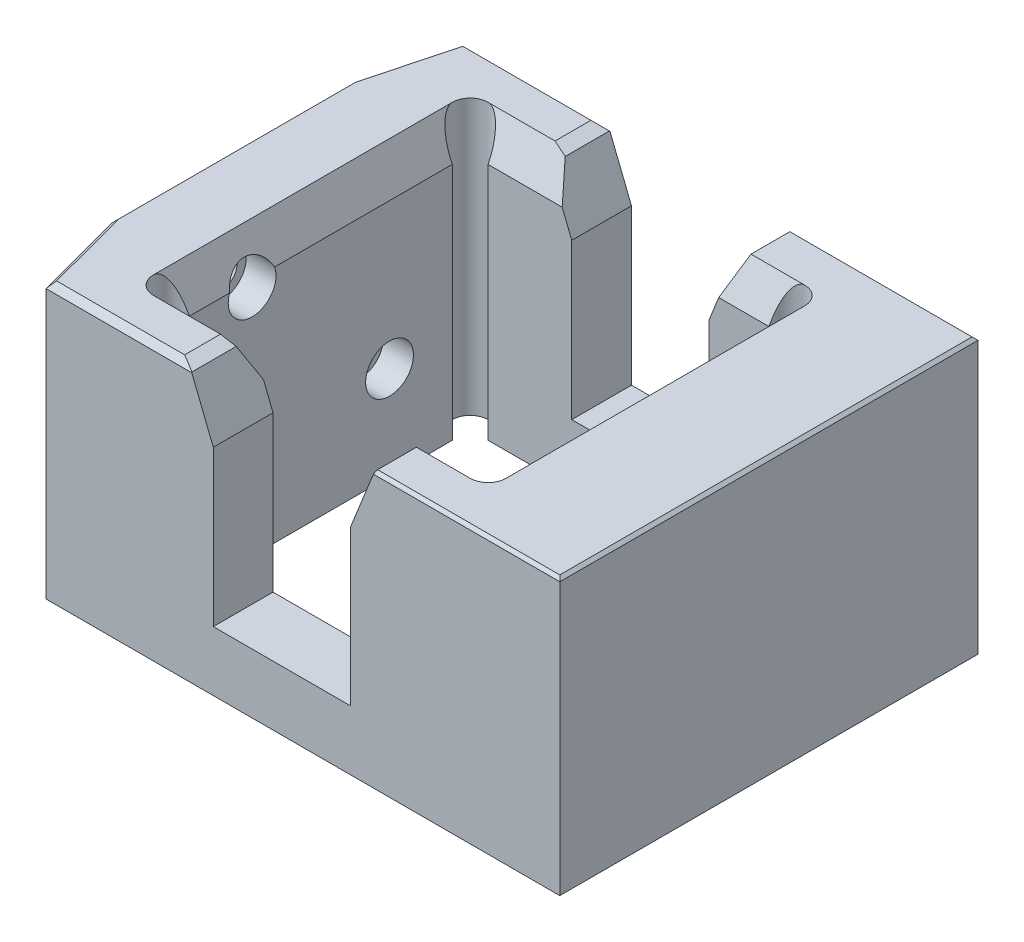
from build123d import *
from OCP.BRepFilletAPI import BRepFilletAPI_MakeChamfer

# Parameters (mm, degrees)
SKETCH1_W           = 90
SKETCH1_H           = 70
BOSS_EXTRUDE1_DEPTH = 46
SKETCH2_W           = 53
SKETCH2_H           = 50
CUT_EXTRUDE1_DEPTH  = 123.947143114
SKETCH3_R           = 3
CUT_EXTRUDE2_DEPTH  = 123.947143114
SKETCH4_W           = 23
SKETCH4_H           = 36
CUT_EXTRUDE3_DEPTH  = 123.947143114
CHAMFER1_SIZE       = 10
CHAMFER1_SIZE2      = 4
CHAMFER2_SIZE       = 4
CHAMFER2_SIZE2      = 10
CHAMFER3_SIZE       = 3
CHAMFER3_SIZE_2     = 6
CHAMFER4_SIZE       = 4
CHAMFER4_SIZE2      = 15
CHAMFER5_SIZE       = 15
CHAMFER5_SIZE2      = 4
CHAMFER6_SIZE       = 1
CHAMFER6_SIZE2      = 1.795054936
CHAMFER7_SIZE       = 0.5
SKETCH5_R           = 2.5
CUT_EXTRUDE4_DEPTH  = 10
SKETCH7_R           = 4
CUT_EXTRUDE5_DEPTH  = 5


with BuildPart() as part:
    # Sketch1 → Boss-Extrude1 (new body)
    with BuildSketch(Plane(origin=(0, 0, 0), x_dir=(1, 0, 0), z_dir=(0, 1, 0))):
        with Locations((45, 35)):
            Rectangle(SKETCH1_W, SKETCH1_H)
    extrude(amount=BOSS_EXTRUDE1_DEPTH)

    # Sketch2 → Cut-Extrude1 (cut, through all)
    with BuildSketch(Plane(origin=(0, 46, 0), x_dir=(1, 0, 0), z_dir=(0, 1, 0))):
        with Locations((41.5, 35)):
            Rectangle(SKETCH2_W, SKETCH2_H)
    extrude(amount=-CUT_EXTRUDE1_DEPTH, mode=Mode.SUBTRACT)

    # Sketch3 → Cut-Extrude2 (cut, through all)
    with BuildSketch(Plane(origin=(0, 46, 0), x_dir=(1, 0, 0), z_dir=(0, 1, 0))):
        with Locations((15, 60)):
            Circle(SKETCH3_R)
        with Locations((68, 60)):
            Circle(SKETCH3_R)
        with Locations((68, 10)):
            Circle(SKETCH3_R)
        with Locations((15, 10)):
            Circle(SKETCH3_R)
    extrude(amount=-CUT_EXTRUDE2_DEPTH, mode=Mode.SUBTRACT)

    # Sketch4 → Cut-Extrude3 (cut, through all)
    with BuildSketch(Plane.XY):
        with Locations((43.5, 28)):
            Rectangle(SKETCH4_W, SKETCH4_H)
    extrude(amount=-CUT_EXTRUDE3_DEPTH, mode=Mode.SUBTRACT)

    # Chamfer1: one chamfer whose edges measure the first distance from different faces: ONE call of the kernel's chamfer builder (chamfer() names one face for all edges)
    chamfer1_edges_1 = [part.edges().sort_by_distance(p)[0] for p in [
        (55, 46, -65),
    ]]
    chamfer1_side_1 = [part.faces().sort_by_distance(p)[0] for p in [
        (55, 28, -65),
    ]]
    chamfer1_edges_2 = [part.edges().sort_by_distance(p)[0] for p in [
        (55, 46, -5),
    ]]
    chamfer1_side_2 = [part.faces().sort_by_distance(p)[0] for p in [
        (55, 28, -5),
    ]]
    chamfer1 = BRepFilletAPI_MakeChamfer(part.part.solid().wrapped)
    for e in chamfer1_edges_1:
        chamfer1.Add(CHAMFER1_SIZE, CHAMFER1_SIZE2, e.wrapped, chamfer1_side_1[0].wrapped)  # the first distance lies on this face
    for e in chamfer1_edges_2:
        chamfer1.Add(CHAMFER1_SIZE, CHAMFER1_SIZE2, e.wrapped, chamfer1_side_2[0].wrapped)  # the first distance lies on this face
    add(Compound.cast(chamfer1.Shape()), mode=Mode.REPLACE)

    # Chamfer2
    chamfer2_edges = [part.edges().sort_by_distance(p)[0] for p in [
        (32, 46, -65),
        (32, 46, -5),
    ]]
    chamfer2_side = [part.faces().sort_by_distance(p)[0] for p in [
        (11.31415673, 46, -35),
    ]]
    chamfer(chamfer2_edges, length=CHAMFER2_SIZE, length2=CHAMFER2_SIZE2, reference=chamfer2_side[0])

    # Chamfer3
    chamfer3_edges_1 = [part.edges().sort_by_distance(p)[0] for p in [
        (62, 46, -10),
    ]]
    chamfer3_side_1 = [part.faces().sort_by_distance(p)[0] for p in [
        (62, 46, -9.94),
    ]]
    chamfer3_edges_2 = [part.edges().sort_by_distance(p)[0] for p in [
        (68, 46, -35),
    ]]
    chamfer3_side_2 = [part.faces().sort_by_distance(p)[0] for p in [
        (68.06, 46, -35),
    ]]
    chamfer3_edges_3 = [part.edges().sort_by_distance(p)[0] for p in [
        (62, 46, -60),
    ]]
    chamfer3_side_3 = [part.faces().sort_by_distance(p)[0] for p in [
        (62, 46, -60.06),
    ]]
    chamfer3_edges_4 = [part.edges().sort_by_distance(p)[0] for p in [
        (23, 46, -60),
    ]]
    chamfer3_side_4 = [part.faces().sort_by_distance(p)[0] for p in [
        (23, 46, -60.06),
    ]]
    chamfer3_edges_5 = [part.edges().sort_by_distance(p)[0] for p in [
        (23, 46, -10),
    ]]
    chamfer3_side_5 = [part.faces().sort_by_distance(p)[0] for p in [
        (23, 46, -9.94),
    ]]
    chamfer3_edges_6 = [part.edges().sort_by_distance(p)[0] for p in [
        (15, 46, -35),
    ]]
    chamfer3_side_6 = [part.faces().sort_by_distance(p)[0] for p in [
        (14.94, 46, -35),
    ]]
    chamfer3 = BRepFilletAPI_MakeChamfer(part.part.solid().wrapped)
    for e in chamfer3_edges_1:
        chamfer3.Add(CHAMFER3_SIZE - 0.0001, CHAMFER3_SIZE_2 - 0.0001, e.wrapped, chamfer3_side_1[0].wrapped)
    for e in chamfer3_edges_2:
        chamfer3.Add(CHAMFER3_SIZE - 0.0001, CHAMFER3_SIZE_2 - 0.0001, e.wrapped, chamfer3_side_2[0].wrapped)
    for e in chamfer3_edges_3:
        chamfer3.Add(CHAMFER3_SIZE - 0.0001, CHAMFER3_SIZE_2 - 0.0001, e.wrapped, chamfer3_side_3[0].wrapped)
    for e in chamfer3_edges_4:
        chamfer3.Add(CHAMFER3_SIZE - 0.0001, CHAMFER3_SIZE_2 - 0.0001, e.wrapped, chamfer3_side_4[0].wrapped)
    for e in chamfer3_edges_5:
        chamfer3.Add(CHAMFER3_SIZE - 0.0001, CHAMFER3_SIZE_2 - 0.0001, e.wrapped, chamfer3_side_5[0].wrapped)
    for e in chamfer3_edges_6:
        chamfer3.Add(CHAMFER3_SIZE - 0.0001, CHAMFER3_SIZE_2 - 0.0001, e.wrapped, chamfer3_side_6[0].wrapped)
    add(Compound.cast(chamfer3.Shape()), mode=Mode.REPLACE)  # a hair under: the kernel refuses the full size

    # Chamfer4
    chamfer4_edges = [part.edges().sort_by_distance(p)[0] for p in [
        (0, 23, -70),
    ]]
    chamfer4_side = [part.faces().sort_by_distance(p)[0] for p in [
        (30.989257699, 23, -70),
    ]]
    chamfer(chamfer4_edges, length=CHAMFER4_SIZE, length2=CHAMFER4_SIZE2, reference=chamfer4_side[0])

    # Chamfer5
    chamfer5_edges = [part.edges().sort_by_distance(p)[0] for p in [
        (0, 23, 0),
    ]]
    chamfer5_side = [part.faces().sort_by_distance(p)[0] for p in [
        (0, 23, -27.5),
    ]]
    chamfer(chamfer5_edges, length=CHAMFER5_SIZE, length2=CHAMFER5_SIZE2, reference=chamfer5_side[0])

    # Chamfer6: one chamfer whose edges measure the first distance from different faces: ONE call of the kernel's chamfer builder (chamfer() names one face for all edges)
    chamfer6_edges_1 = [part.edges().sort_by_distance(p)[0] for p in [
        (16, 46, -70),
        (0, 46, -35),
        (2, 46, -62.5),
        (16, 46, 0),
        (2, 46, -7.5),
    ]]
    chamfer6_edges_2 = [part.edges().sort_by_distance(p)[0] for p in [
        (28, 46, -3.50005),
    ]]
    chamfer6_side_2 = [part.faces().sort_by_distance(p)[0] for p in [
        (30.118676116, 40.703309709, -4.604414044),
    ]]
    chamfer6_edges_3 = [part.edges().sort_by_distance(p)[0] for p in [
        (28, 46, -66.49995),
    ]]
    chamfer6_side_3 = [part.faces().sort_by_distance(p)[0] for p in [
        (30.118676116, 40.703309709, -65.395585956),
    ]]
    chamfer6 = BRepFilletAPI_MakeChamfer(part.part.solid().wrapped)
    for e in chamfer6_edges_1:
        chamfer6.Add(CHAMFER6_SIZE, e.wrapped)
    for e in chamfer6_edges_2:
        chamfer6.Add(CHAMFER6_SIZE, CHAMFER6_SIZE2, e.wrapped, chamfer6_side_2[0].wrapped)  # the first distance lies on this face
    for e in chamfer6_edges_3:
        chamfer6.Add(CHAMFER6_SIZE, CHAMFER6_SIZE2, e.wrapped, chamfer6_side_3[0].wrapped)  # the first distance lies on this face
    add(Compound.cast(chamfer6.Shape()), mode=Mode.REPLACE)

    # Chamfer7
    chamfer7_edges = [part.edges().sort_by_distance(p)[0] for p in [
        (74.5, 46, 0),
        (90, 46, -35),
        (74.5, 46, -70),
    ]]
    chamfer(chamfer7_edges, length=CHAMFER7_SIZE)

    # Sketch5 → Cut-Extrude4 (cut)
    with BuildSketch(Plane.ZY):
        with Locations((-23.5, 38.65)):
            Circle(SKETCH5_R)
        with Locations((-46.5, 15.65)):
            Circle(SKETCH5_R)
    extrude(amount=-CUT_EXTRUDE4_DEPTH, mode=Mode.SUBTRACT)

    # Sketch7 → Cut-Extrude5 (cut)
    with BuildSketch(Plane(origin=(15, 0, 0), x_dir=(0, 0, -1), z_dir=(1, 0, 0))):
        with Locations((23.5, 38.65)):
            Circle(SKETCH7_R)
        with Locations((46.5, 15.65)):
            Circle(SKETCH7_R)
    extrude(amount=-CUT_EXTRUDE5_DEPTH, mode=Mode.SUBTRACT)


solid = part.part
